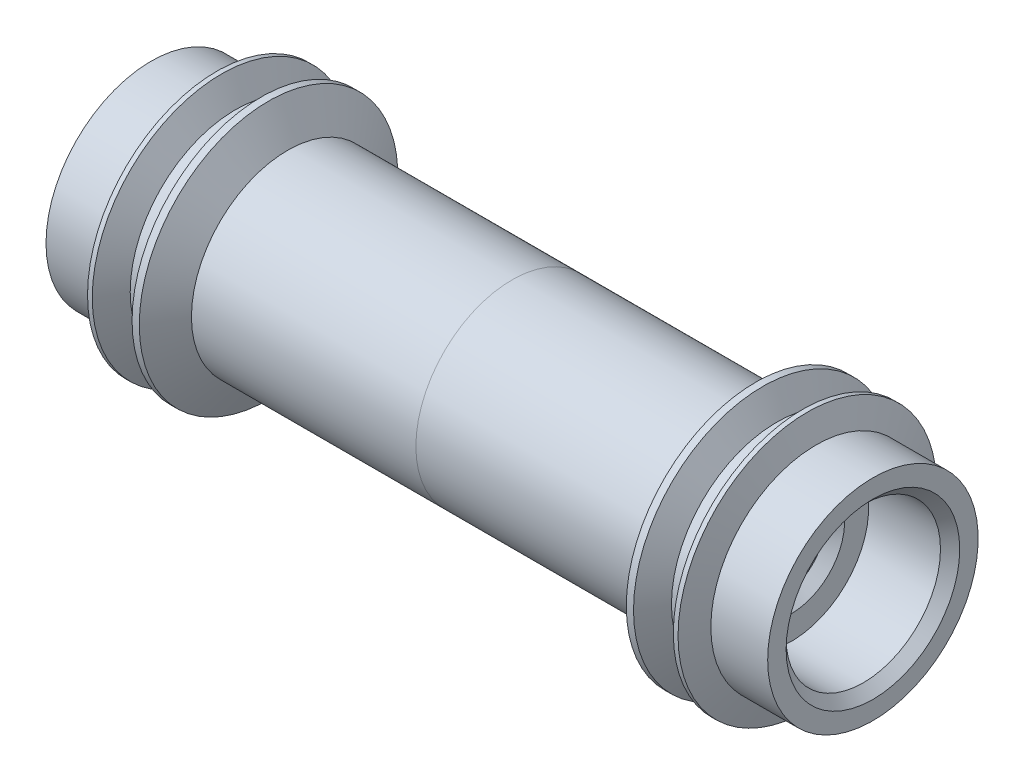
from build123d import *

# Parameters (mm, degrees)
CHAMFER1_SIZE = 0.508


with BuildPart() as part:
    # Sketch2 → Revolve1 (revolve)
    with BuildSketch(Plane.XY):
        Polygon((-16.05, 5.55625), (-19.05, 5.55625), (-19.05, 4.075), (-14.749999964, 4.075), (-14.749999964, 2.805), (-14.241999964, 2.297), (-14.241999964, 1.905), (-9.098, 1.905), (-9.098, 0), (-8.125000052, 0), (-6.5, 1.625000052), (0, 1.625000052), (0, 5.08), (-11.847567251, 5.08), (-12.855765158, 6.82625), (-13.236765158, 6.82625), (-13.97, 5.55625), (-14.605, 5.55625), (-15.338234842, 6.82625), (-15.587757802, 6.82625), align=None)
    revolve(axis=Axis((-19.05, 0, 0), (1, 0, 0)))

    # Chamfer1
    chamfer1_edges = [part.edges().sort_by_distance(p)[0] for p in [
        (-19.05, -4.075, 0),
    ]]
    chamfer(chamfer1_edges, length=CHAMFER1_SIZE)


with BuildPart() as body_2:
    # Mirror1: mirrored copy
    add(part.part.mirror(Plane(origin=(0, 0, 0), x_dir=(0, 0, 1), z_dir=(1, 0, 0))))


solid = Compound([part.part, body_2.part])
